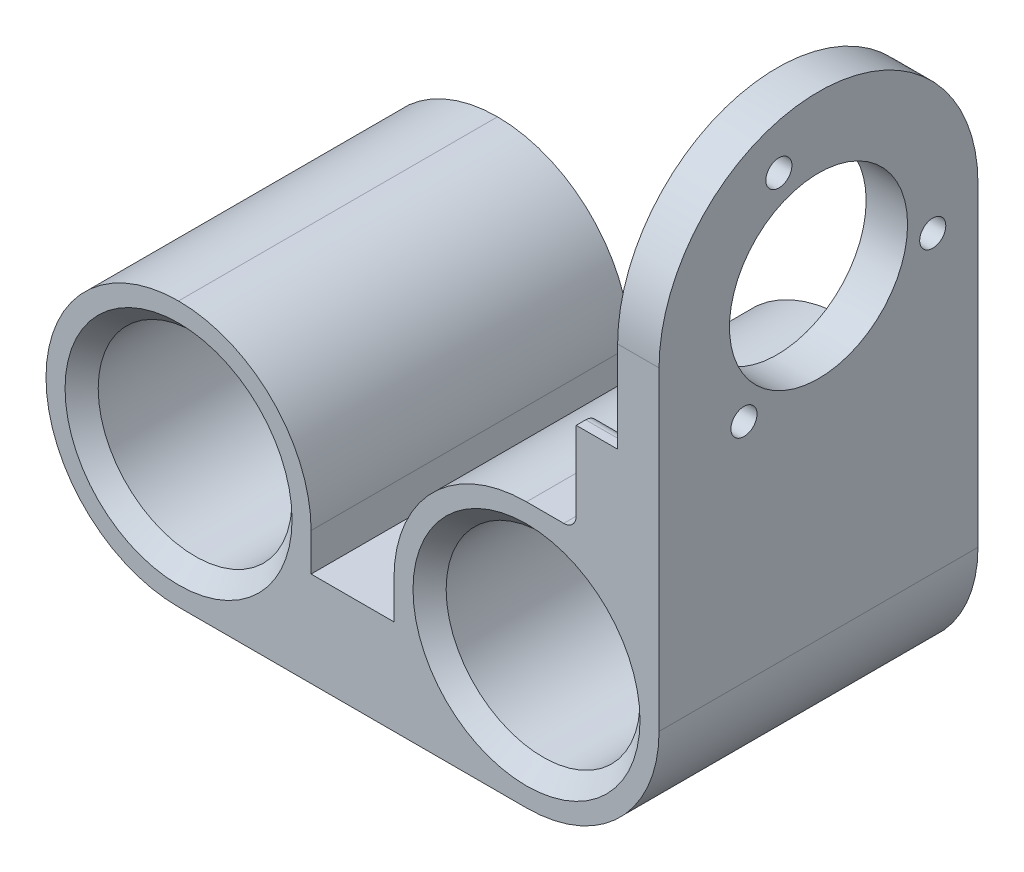
from build123d import *

# Parameters (mm, degrees)
SKETCH1_W               = 74
SKETCH1_H               = 32
SKETCH1_R               = 11.7
BOSS_EXTRUDE1_DEPTH     = 38.5
SKETCH2_R               = 1.575
SKETCH2_R_2             = 10.75
BOSS_EXTRUDE2_DEPTH     = 5
BOSS_EXTRUDE3_DEPTH     = 5
CUT_EXTRUDE1_DEPTH      = 112.012668196
CUT_EXTRUDE1_DEPTH_BACK = 112.012668196
SKETCH4_W               = 10
SKETCH4_H               = 25
SKETCH4_H_2             = 4.450035805
SKETCH5_R               = 2.15
CUT_EXTRUDE2_DEPTH      = 18
FILLET8_R               = 16
FILLET9_R               = 1.5
FILLET10_SIZE           = 2
CUT_EXTRUDE3_DEPTH      = 3


with BuildPart() as part:
    # Sketch1 → Boss-Extrude1 (new body)
    with BuildSketch(Plane.XY):
        with Locations((37, 16)):
            Rectangle(SKETCH1_W, SKETCH1_H)
        with Locations((16, 16)):
            Circle(SKETCH1_R, mode=Mode.SUBTRACT)
        with Locations((58, 16)):
            Circle(SKETCH1_R, mode=Mode.SUBTRACT)
    extrude(amount=BOSS_EXTRUDE1_DEPTH)

    # Sketch2 → Boss-Extrude2 (add)
    # profile 1 of 2: a face of its own
    with BuildSketch(Plane(origin=(74, 0, 0), x_dir=(0, 0, -1), z_dir=(1, 0, 0))):
        with BuildLine():
            Line((-38.5, 32), (0, 32))
            Line((0, 32), (0, 54))
            ThreePointArc((0, 54), (-19.25, 34.75), (-38.5, 54))
            Line((-38.5, 54), (-38.5, 32))
        make_face()
    # profile 2 of 2: a face of its own
    with BuildSketch(Plane(origin=(74, 0, 0), x_dir=(0, 0, -1), z_dir=(1, 0, 0))):
        with BuildLine():
            ThreePointArc((-38.5, 54), (-19.25, 34.75), (0, 54))
            ThreePointArc((0, 54), (-19.25, 73.25), (-38.5, 54))
        make_face()
        with Locations((-28.249026536, 43.275377796)):
            Circle(SKETCH2_R, mode=Mode.SUBTRACT)
        with Locations((-24.038282007, 67.155696691)):
            Circle(SKETCH2_R, mode=Mode.SUBTRACT)
        with Locations((-19.25, 54)):
            Circle(SKETCH2_R_2, mode=Mode.SUBTRACT)
        with Locations((-5.462691458, 51.568925513)):
            Circle(SKETCH2_R, mode=Mode.SUBTRACT)
    extrude(amount=-BOSS_EXTRUDE2_DEPTH)

    # Sketch3 → Boss-Extrude3 (add)
    with BuildSketch(Plane.ZY.offset(-69)):
        with BuildLine():
            Line((0, 43), (0, 32))
            Line((0, 32), (38.5, 32))
            Line((38.5, 32), (38.5, 43))
            Line((38.5, 43), (36.548843892, 43))
            ThreePointArc((36.548843892, 43), (19.25, 33.5), (1.951156108, 43))
            Line((1.951156108, 43), (0, 43))
        make_face()
    extrude(amount=BOSS_EXTRUDE3_DEPTH)

    # Sketch4 → Cut-Extrude1 (cut, two sides: drawn at the far end of the back side and taken through both)
    with BuildSketch(Plane(origin=(0, 0, 0), x_dir=(-1, 0, 0), z_dir=(0, 0, -1)).offset(-CUT_EXTRUDE1_DEPTH_BACK)):
        with Locations((-37, 23.950035805)):
            Rectangle(SKETCH4_W, SKETCH4_H)
        with Locations((-37, 34.225017902)):
            Rectangle(SKETCH4_W, SKETCH4_H_2)
    extrude(amount=CUT_EXTRUDE1_DEPTH + CUT_EXTRUDE1_DEPTH_BACK, mode=Mode.SUBTRACT)

    # Sketch5 → Cut-Extrude2 (cut)
    with BuildSketch(Plane(origin=(0, 11.450035805, 0), x_dir=(1, 0, 0), z_dir=(0, 1, 0))):
        with Locations(Location((37, -19.25, 0), (0, 0, 270))):
            Circle(SKETCH5_R)
    extrude(amount=-CUT_EXTRUDE2_DEPTH, mode=Mode.SUBTRACT)

    # Fillet8
    fillet8_edges = [part.edges().sort_by_distance(p)[0] for p in [
        (42, 32, 19.25),
        (32, 32, 19.25),
        (0, 32, 19.25),
        (0, 0, 19.25),
        (74, 0, 19.25),
    ]]
    fillet(fillet8_edges, radius=FILLET8_R - 0.0001)  # a hair under: the kernel refuses the full size

    # Fillet9
    fillet9_edges = [part.edges().sort_by_distance(p)[0] for p in [
        (66.5, 43, 36.548843892),
        (66.5, 43, 1.951156108),
        (64, 32, 19.25),
    ]]
    fillet(fillet9_edges, radius=FILLET9_R - 0.0001)  # a hair under: the kernel refuses the full size

    # Fillet10
    fillet10_edges = [part.edges().sort_by_distance(p)[0] for p in [
        (4.3, 16, 0),
        (4.3, 16, 38.5),
        (46.3, 16, 0),
        (46.3, 16, 38.5),
    ]]
    chamfer(fillet10_edges, length=FILLET10_SIZE)

    # Sketch6 → Cut-Extrude3 (cut)
    with BuildSketch(Plane.XZ):
        Polygon((39.110229916, 15.468871901), (41.329667947, 19.186948665), (39.219438031, 22.968076764), (34.889770084, 23.031128099), (32.670332053, 19.313051335), (34.780561969, 15.531923236), align=None)
    extrude(amount=-CUT_EXTRUDE3_DEPTH, mode=Mode.SUBTRACT)


solid = part.part
